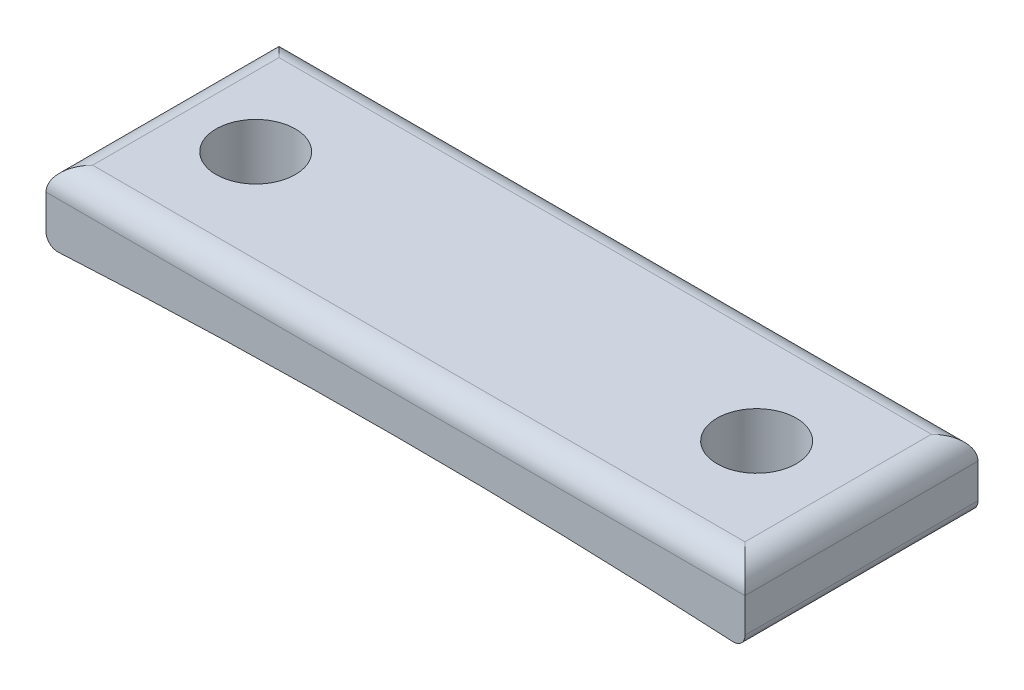
from build123d import *

# Parameters (mm, degrees)
SKETCH1_W               = 30
SKETCH1_H               = 10
BOSS_EXTRUDE1_DEPTH     = 3
M3_CLEARANCE_HOLE1_D    = 3.4
FILLET3_R               = 1
CUT_EXTRUDE4_DEPTH      = 26.961054127
CUT_EXTRUDE4_DEPTH_BACK = 26.961054127
FILLET4_R               = 0.5


with BuildPart() as part:
    # Sketch1 → Boss-Extrude1 (new body)
    with BuildSketch(Plane(origin=(0, 0, 0), x_dir=(1, 0, 0), z_dir=(0, 1, 0))):
        with Locations((8.769230769, -2)):
            Rectangle(SKETCH1_W, SKETCH1_H)
    extrude(amount=BOSS_EXTRUDE1_DEPTH)

    # M3 Clearance Hole1 (through all)
    with Locations(Plane(origin=(0, 3, 0), x_dir=(1, 0, 0), z_dir=(0, 1, 0))):
        with Locations((-2.230769231, -2), (19.269230769, -2)):
            Hole(M3_CLEARANCE_HOLE1_D / 2)

    # Fillet3
    fillet3_edges = [part.edges().sort_by_distance(p)[0] for p in [
        (-6.230769231, 3, 2),
        (8.769230769, 3, 7),
        (23.769230769, 3, 2),
        (8.769230769, 3, -3),
    ]]
    fillet(fillet3_edges, radius=FILLET3_R)

    # Sketch8 → Cut-Extrude4 (cut, two sides: drawn at the far end of the back side and taken through both)
    with BuildSketch(Plane.XY.offset(7).offset(-CUT_EXTRUDE4_DEPTH_BACK)):
        with BuildLine():
            Line((-76.416523932, -3.993108), (-6.230769231, 0))
            ThreePointArc((-6.230769231, 0), (8.769230769, 0.426355955), (23.769230769, 0))
            Line((23.769230769, 0), (93.954985471, -3.993108))
            Line((93.954985471, -3.993108), (93.954985471, -144.591615454))
            Line((93.954985471, -144.591615454), (-76.416523932, -144.591615454))
            Line((-76.416523932, -144.591615454), (-76.416523932, -3.993108))
        make_face()
    extrude(amount=CUT_EXTRUDE4_DEPTH + CUT_EXTRUDE4_DEPTH_BACK, mode=Mode.SUBTRACT)

    # Fillet4
    fillet4_edges = [part.edges().sort_by_distance(p)[0] for p in [
        (23.769230769, 0, 2),
        (-6.230769231, 0, 2),
    ]]
    fillet(fillet4_edges, radius=FILLET4_R)


solid = part.part
